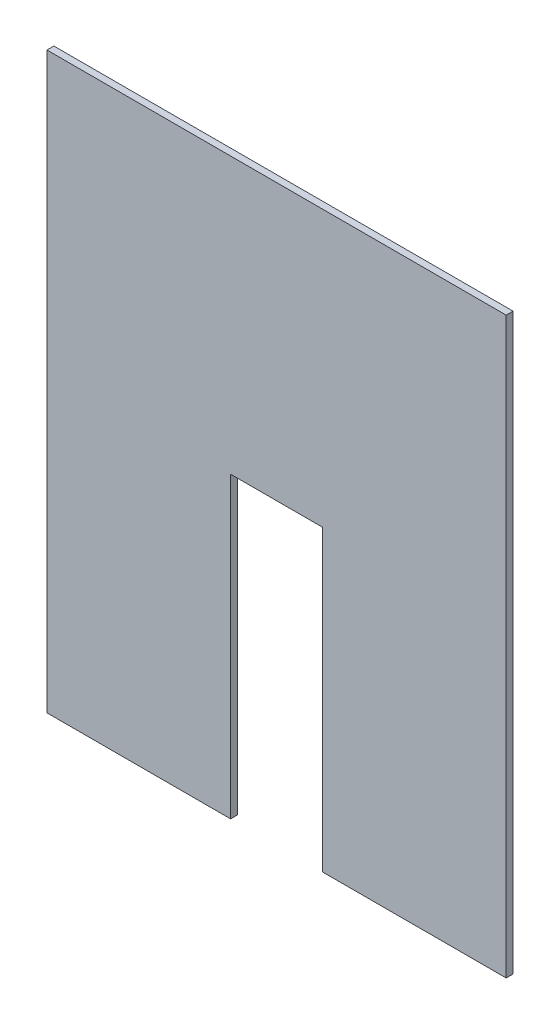
from build123d import *

# Parameters (mm, degrees)
RESSALTO_EXTRUS_O1_DEPTH = 3


with BuildPart() as part:
    # Esboço1 → Ressalto-extrusão1 (new body)
    with BuildSketch(Plane.XY):
        Polygon((-100, 125), (100, 125), (100, -125), (20, -125), (20, 5), (-20, 5), (-20, -125), (-100, -125), align=None)
    extrude(amount=RESSALTO_EXTRUS_O1_DEPTH)


solid = part.part
